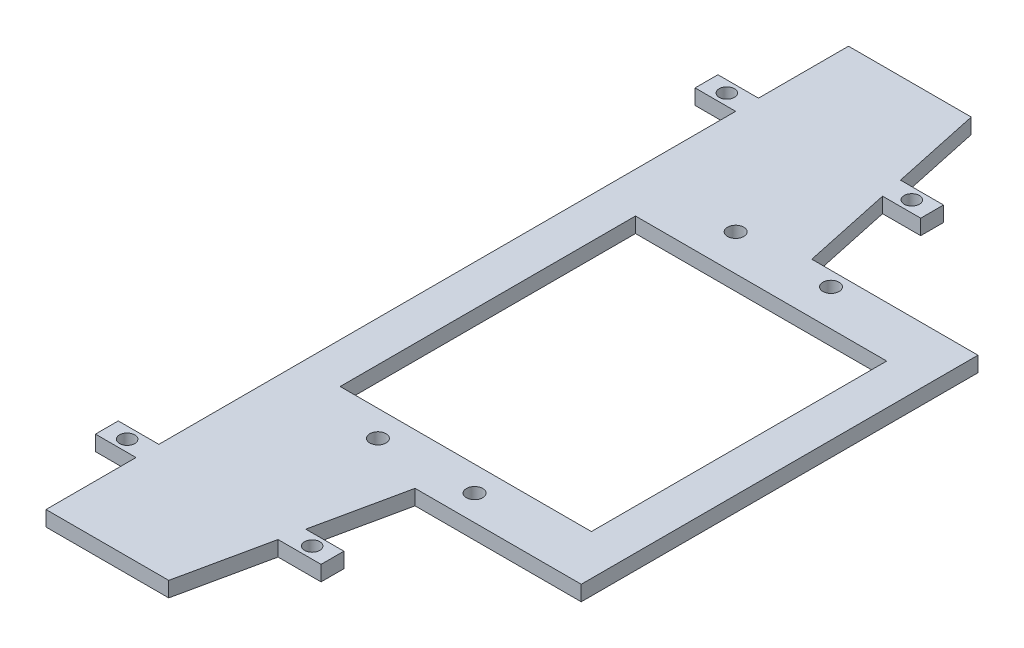
from build123d import *

# Parameters (mm, degrees)
SKETCH1_R           = 1.6
SKETCH1_R_2         = 1.599939077
SKETCH1_W           = 49.532
SKETCH1_H           = 58.229021166
SKETCH1_R_3         = 1.599995589
SKETCH1_R_4         = 1.5
BOSS_EXTRUDE1_DEPTH = 3


with BuildPart() as part:
    # Sketch1 → Boss-Extrude1 (new body)
    with BuildSketch(Plane(origin=(0, 0, 0), x_dir=(1, 0, 0), z_dir=(0, 1, 0))):
        Polygon((65.532, 39.114510583), (32.766, 39.114510583), (28.9648375, 56.864510583), (36.483, 56.864510583), (36.483, 61.364510583), (28.0011625, 61.364510583), (24.2, 79.114510583), (0, 79.114510583), (0, 61.364510583), (-8, 61.364510583), (-8, 56.864510583), (0, 56.864510583), (0, -56.864510583), (-8, -56.864510583), (-8, -61.364510583), (0, -61.364510583), (0, -79.114510583), (24.2, -79.114510583), (28.0011625, -61.364510583), (36.483, -61.364510583), (36.483, -56.864510583), (28.9648375, -56.864510583), (32.766, -39.114510583), (65.532, -39.114510583), align=None)
        with Locations((20.574, -34.241549338)):
            Circle(SKETCH1_R, mode=Mode.SUBTRACT)
        with Locations((39.450944, -34.068499927)):
            Circle(SKETCH1_R_2, mode=Mode.SUBTRACT)
        with Locations((32.766, 0)):
            Rectangle(SKETCH1_W, SKETCH1_H, mode=Mode.SUBTRACT)
        with Locations((20.574, 36.286821056)):
            Circle(SKETCH1_R_3, mode=Mode.SUBTRACT)
        with Locations((39.37, 36.286821056)):
            Circle(SKETCH1_R_2, mode=Mode.SUBTRACT)
        with Locations((-4, 59.114510583)):
            Circle(SKETCH1_R_4, mode=Mode.SUBTRACT)
        with Locations((32.483, 59.114510583)):
            Circle(SKETCH1_R_4, mode=Mode.SUBTRACT)
        with Locations((32.483, -59.114510583)):
            Circle(SKETCH1_R_4, mode=Mode.SUBTRACT)
        with Locations((-4, -59.114510583)):
            Circle(SKETCH1_R_4, mode=Mode.SUBTRACT)
    extrude(amount=BOSS_EXTRUDE1_DEPTH)


solid = part.part
